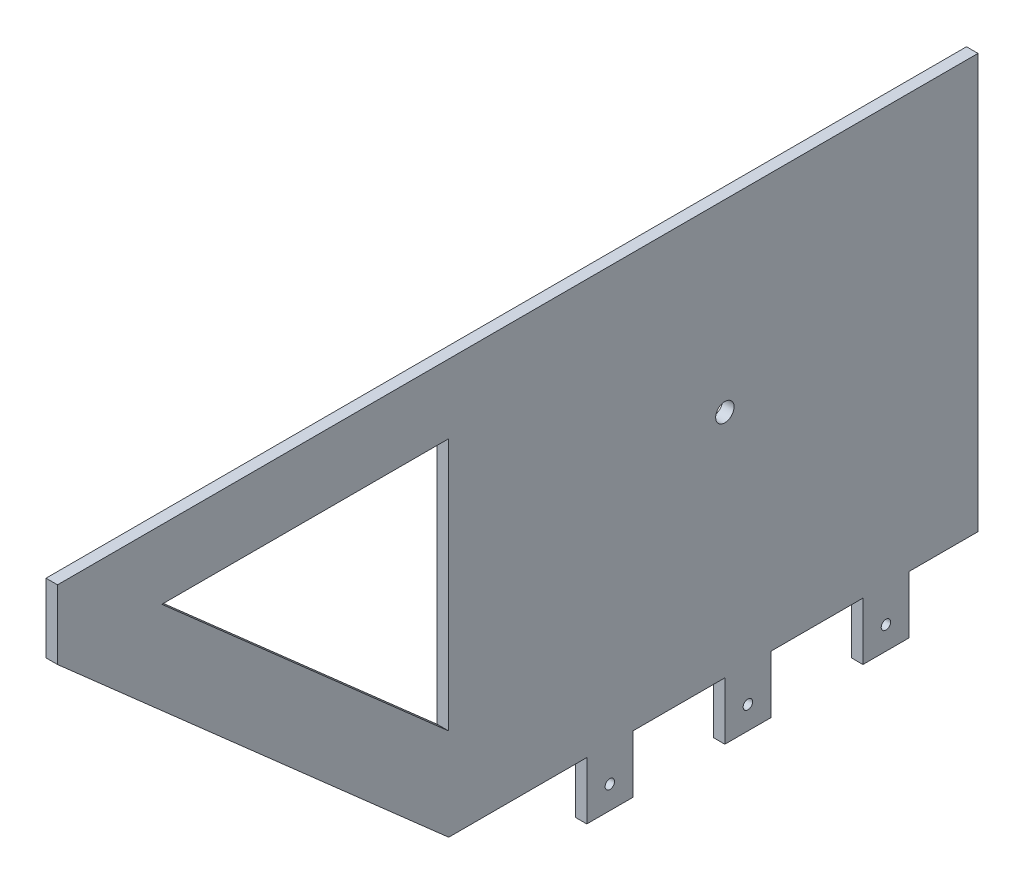
from build123d import *

# Parameters (mm, degrees)
SKETCH_1_W      = 200
SKETCH_1_H      = 180
SKETCH_1_R      = 4
EXTRUDE_1_DEPTH = 5
SKETCH_2_W      = 20
SKETCH_2_H      = 25
SKETCH_2_R      = 2.05
EXTRUDE_2_DEPTH = 5
EXTRUDE_3_DEPTH = 5


with BuildPart() as part:
    # 草圖1 → 填料-伸長1 (new body)
    with BuildSketch(Plane(origin=(0, 0, 0), x_dir=(0, 0, -1), z_dir=(1, 0, 0))):
        Rectangle(SKETCH_1_W, SKETCH_1_H)
        with Locations((-10, 10)):
            Circle(SKETCH_1_R, mode=Mode.SUBTRACT)
    extrude(amount=EXTRUDE_1_DEPTH)

    # 草圖2 → 填料-伸長2 (add)
    # profile 1 of 3: a face of its own
    with BuildSketch(Plane(origin=(5, 0, 0), x_dir=(0, 0, -1), z_dir=(1, 0, 0))):
        with Locations((-60, -102.5)):
            Rectangle(SKETCH_2_W, SKETCH_2_H)
        with Locations((-60, -105)):
            Circle(SKETCH_2_R, mode=Mode.SUBTRACT)
    # profile 2 of 3: a face of its own
    with BuildSketch(Plane(origin=(5, 0, 0), x_dir=(0, 0, -1), z_dir=(1, 0, 0))):
        with Locations((0, -102.5)):
            Rectangle(SKETCH_2_W, SKETCH_2_H)
        with Locations((0, -105)):
            Circle(SKETCH_2_R, mode=Mode.SUBTRACT)
    # profile 3 of 3: a face of its own
    with BuildSketch(Plane(origin=(5, 0, 0), x_dir=(0, 0, -1), z_dir=(1, 0, 0))):
        with Locations((60, -102.5)):
            Rectangle(SKETCH_2_W, SKETCH_2_H)
        with Locations((60, -105)):
            Circle(SKETCH_2_R, mode=Mode.SUBTRACT)
    extrude(amount=-EXTRUDE_2_DEPTH)

    # 草圖3 → 填料-伸長3 (add)
    with BuildSketch(Plane(origin=(5, 0, 0), x_dir=(0, 0, -1), z_dir=(1, 0, 0))):
        Polygon((-100, 90), (-300, 90), (-300, 60), (-130, -90), (-100, -90), align=None)
        Polygon((-130, 60), (-130, -49.991350416), (-254.656863805, 60), align=None, mode=Mode.SUBTRACT)
    extrude(amount=-EXTRUDE_3_DEPTH)


solid = part.part
